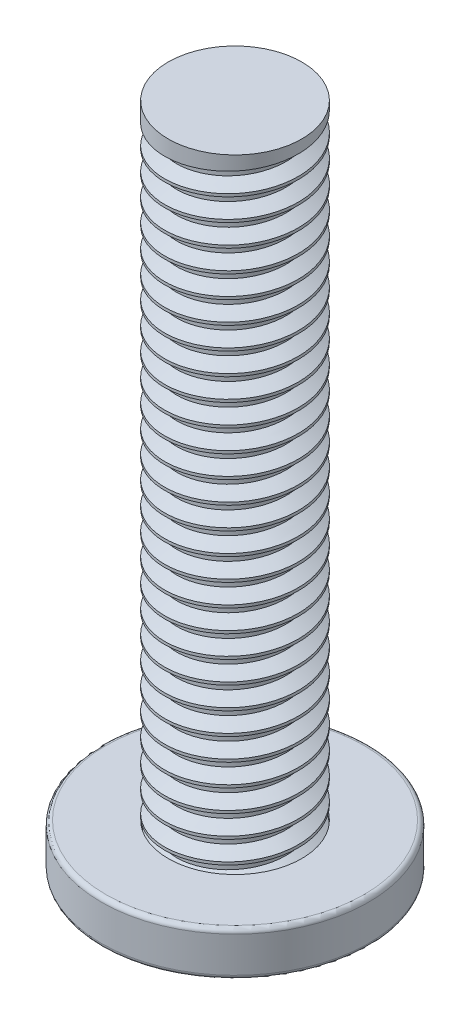
from build123d import *

# Parameters (mm, degrees)
SKETCH2_R           = 3
BOSS_EXTRUDE1_DEPTH = 1
SKETCH3_R           = 1.5
BOSS_EXTRUDE2_DEPTH = 14
THREAD1_PITCH       = 0.5
CUT_EXTRUDE1_DEPTH  = 0.5
FILLET1_R           = 0.1


with BuildPart() as part:
    # Sketch2 → Boss-Extrude1 (new body)
    with BuildSketch(Plane(origin=(0, 0, 0), x_dir=(1, 0, 0), z_dir=(0, 1, 0))):
        with Locations(Location((0, 0, 0), (0, 0, 270))):
            Circle(SKETCH2_R)
    extrude(amount=BOSS_EXTRUDE1_DEPTH)

    # Sketch3 → Boss-Extrude2 (add)
    with BuildSketch(Plane(origin=(0, 1, 0), x_dir=(1, 0, 0), z_dir=(0, 1, 0))):
        with Locations(Location((0, 0, 0), (0, 0, 270))):
            Circle(SKETCH3_R)
    extrude(amount=BOSS_EXTRUDE2_DEPTH)

    # Thread1: the profile of Thread Profile1 profile screwed along a right-hand helix of 28 turns, 6 arcs to a turn; built about Z, then put on its axis
    thread1_z = Axis((0, 0, 0), (0, 0, 1))
    thread1_corners = [(1.5003, 0, -0.000173205), (1.5003, 0, 0.437673204), (1.229367063, 0, 0.281249999), (1.229367063, 0, 0.156249999)]
    with BuildLine(mode=Mode.PRIVATE) as thread1_profile:
        Line(thread1_corners[0], thread1_corners[1])
        Line(thread1_corners[1], thread1_corners[2])
        Line(thread1_corners[2], thread1_corners[3])
        Line(thread1_corners[3], thread1_corners[0])
    thread1_cap = Face(thread1_profile.wire())
    thread1_turn_angles = [0, 30, 60, 90, 120, 150, 180, 210, 240, 270, 300, 330, 360]
    thread1_turn_weights = [1, 0.8660254037844387, 1, 0.8660254037844387, 1, 0.8660254037844387, 1, 0.8660254037844387, 1, 0.8660254037844387, 1, 0.8660254037844387, 1]
    thread1_turn_rails = [Edge.make_bspline([Vector(p[0], p[1], 0).rotate(thread1_z, thread1_turn_angles[k]) / thread1_turn_weights[k] + Vector(0, 0, p[2] + THREAD1_PITCH * thread1_turn_angles[k] / 360) for k in range(13)], [0, 0, 0, 1, 1, 2, 2, 3, 3, 4, 4, 5, 5, 6, 6, 6], 2, thread1_turn_weights) for p in thread1_corners]
    thread1_turn_sides = [Face.make_surface_from_curves(thread1_turn_rails[p[0]], thread1_turn_rails[p[1]]) for p in [(0, 1), (1, 2), (2, 3), (3, 0)]]
    thread1 = Plane(origin=(0, 15, 0), x_dir=(-1, 0, 0), z_dir=(0, -1, 0)) * Solid(Shell([*[p.moved(Location((0, 0, THREAD1_PITCH * i))) for i in range(28) for p in thread1_turn_sides], thread1_cap, thread1_cap.rotate(thread1_z, 10080).moved(Location((0, 0, THREAD1_PITCH * 10080 / 360)))]))
    add(thread1, mode=Mode.SUBTRACT)

    # Sketch13 → Cut-Extrude1 (cut)
    with BuildSketch(Plane.XZ):
        Polygon((1.154700538, 0), (0.577350269, 1), (-0.577350269, 1), (-1.154700538, 0), (-0.577350269, -1), (0.577350269, -1), align=None)
    extrude(amount=-CUT_EXTRUDE1_DEPTH, mode=Mode.SUBTRACT)

    # Fillet1
    fillet1_edges = [part.edges().sort_by_distance(p)[0] for p in [
        (0, 0, -3),
        (0, 1, -3),
    ]]
    fillet(fillet1_edges, radius=FILLET1_R)


solid = part.part
